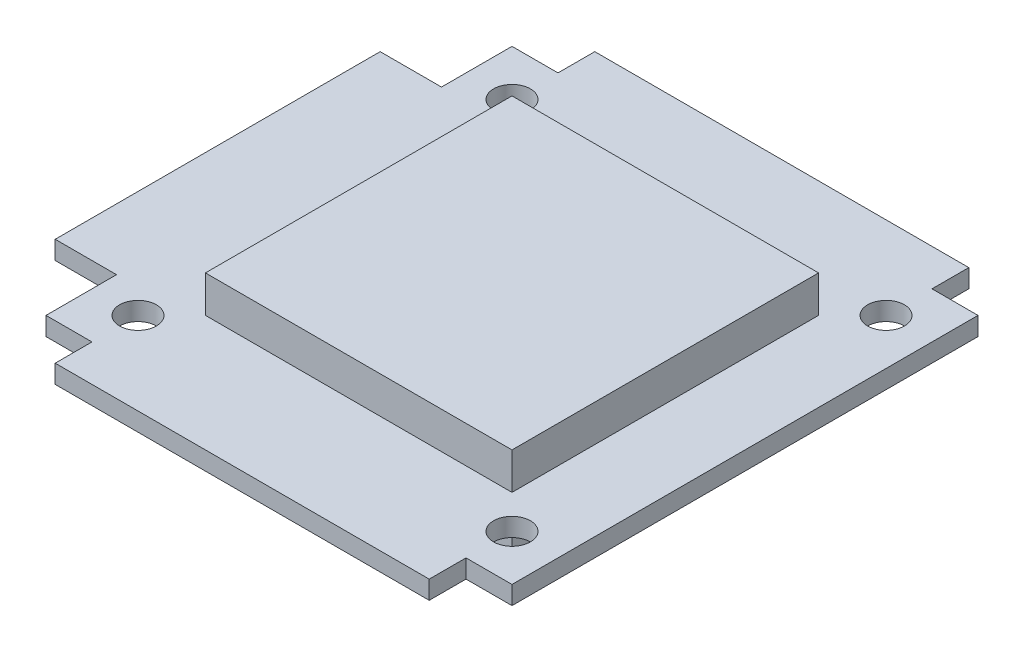
from build123d import *

# Parameters (mm, degrees)
SKETCH_1_W           = 38
SKETCH_1_H           = 38
SKETCH_1_R           = 1.5
EXTRUDE_1_DEPTH      = 1.5
SKETCH_2_W           = 5
SKETCH_2_H           = 26.5
SKETCH_2_W_2         = 30.5
SKETCH_2_H_2         = 3
EXTRUDE_2_DEPTH      = 1.5
EXTRUDE_3_DEPTH      = 3
EXTRUDE_3_DEPTH_BACK = 4.5
SKETCH_3_W           = 25
SKETCH_3_H           = 25


with BuildPart() as part:
    # 草图1 → 凸台-拉伸1 (new body)
    with BuildSketch(Plane(origin=(0, 0, 0), x_dir=(1, 0, 0), z_dir=(0, 1, 0))):
        Rectangle(SKETCH_1_W, SKETCH_1_H)
        with Locations((-15.25, 15.25)):
            Circle(SKETCH_1_R, mode=Mode.SUBTRACT)
        with Locations((15.25, 15.25)):
            Circle(SKETCH_1_R, mode=Mode.SUBTRACT)
        with Locations((15.25, -15.25)):
            Circle(SKETCH_1_R, mode=Mode.SUBTRACT)
        with Locations((-15.25, -15.25)):
            Circle(SKETCH_1_R, mode=Mode.SUBTRACT)
    extrude(amount=EXTRUDE_1_DEPTH)

    # 草图2 → 凸台-拉伸2 (add)
    with BuildSketch(Plane.XZ):
        with Locations((-21.5, 0)):
            Rectangle(SKETCH_2_W, SKETCH_2_H)
        with Locations((0, -20.5)):
            Rectangle(SKETCH_2_W_2, SKETCH_2_H_2)
        with Locations((0, 20.5)):
            Rectangle(SKETCH_2_W_2, SKETCH_2_H_2)
    extrude(amount=-EXTRUDE_2_DEPTH)

    # 草图3 → 凸台-拉伸3 (add, two sides: drawn at the far end of the back side and taken through both)
    with BuildSketch(Plane(origin=(0, 1.5, 0), x_dir=(1, 0, 0), z_dir=(0, 1, 0)).offset(-EXTRUDE_3_DEPTH_BACK)):
        Rectangle(SKETCH_3_W, SKETCH_3_H)
    extrude(amount=EXTRUDE_3_DEPTH + EXTRUDE_3_DEPTH_BACK)


solid = part.part
